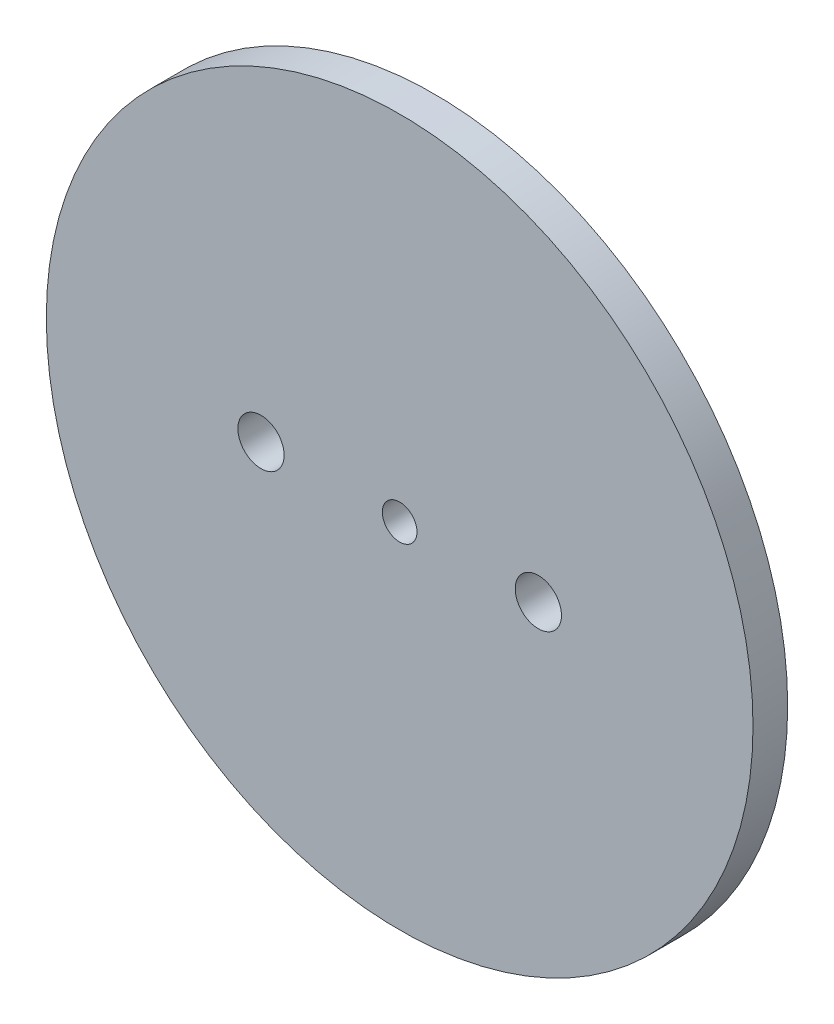
from build123d import *

# Parameters (mm, degrees)
SKETCH1_R           = 48.5394
BOSS_EXTRUDE1_DEPTH = 4.7625
SKETCH2_R           = 2.38125
SKETCH2_R_2         = 3.175
CUT_EXTRUDE1_DEPTH  = 69.810087276


with BuildPart() as part:
    # Sketch1 → Boss-Extrude1 (new body)
    with BuildSketch(Plane.XY):
        Circle(SKETCH1_R)
    extrude(amount=BOSS_EXTRUDE1_DEPTH)

    # Sketch2 → Cut-Extrude1 (cut, through all)
    with BuildSketch(Plane.XY.offset(4.7625)):
        Circle(SKETCH2_R)
        with Locations((19.05, 0)):
            Circle(SKETCH2_R_2)
        with Locations((-19.05, 0)):
            Circle(SKETCH2_R_2)
    extrude(amount=-CUT_EXTRUDE1_DEPTH, mode=Mode.SUBTRACT)


solid = part.part
